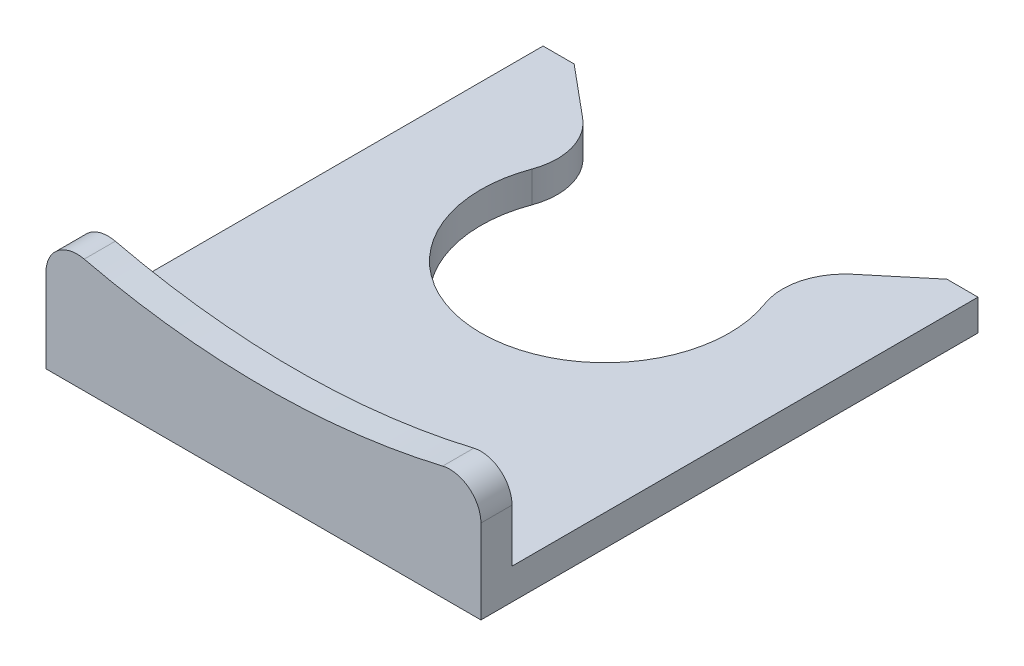
from build123d import *

# Parameters (mm, degrees)
EXTRUDE1_DEPTH = 1
EXTRUDE2_DEPTH = 1
FILLET1_R      = 1


with BuildPart() as part:
    # Sketch1 → Extrude1 (new body)
    with BuildSketch(Plane(origin=(0, 0, 0), x_dir=(1, 0, 0), z_dir=(0, 1, 0))):
        with BuildLine():
            Line((-7, 8), (-6, 8))
            Line((-6, 8), (-4.34571581, 6.621429842))
            ThreePointArc((-4.34571581, 6.621429842), (-3.693602337, 5.600266108), (-3.750723073, 4.389991522))
            ThreePointArc((-3.750723073, 4.389991522), (0, -1), (3.750723073, 4.389991522))
            ThreePointArc((3.750723073, 4.389991522), (3.693602337, 5.600266108), (4.34571581, 6.621429842))
            Line((4.34571581, 6.621429842), (6, 8))
            Line((6, 8), (7, 8))
            Line((7, 8), (7, -8))
            Line((7, -8), (-7, -8))
            Line((-7, -8), (-7, 8))
        make_face()
    extrude(amount=EXTRUDE1_DEPTH)

    # Sketch2 → Extrude2 (add)
    with BuildSketch(Plane.XY.offset(8)):
        with BuildLine():
            Line((-7, 0), (7, 0))
            Line((7, 0), (7, 4))
            ThreePointArc((7, 4), (0, 3), (-7, 4))
            Line((-7, 4), (-7, 0))
        make_face()
    extrude(amount=-EXTRUDE2_DEPTH)

    # Fillet1
    fillet1_edges = [part.edges().sort_by_distance(p)[0] for p in [
        (7, 4, 7.5),
        (-7, 4, 7.5),
    ]]
    fillet(fillet1_edges, radius=FILLET1_R)


solid = part.part
